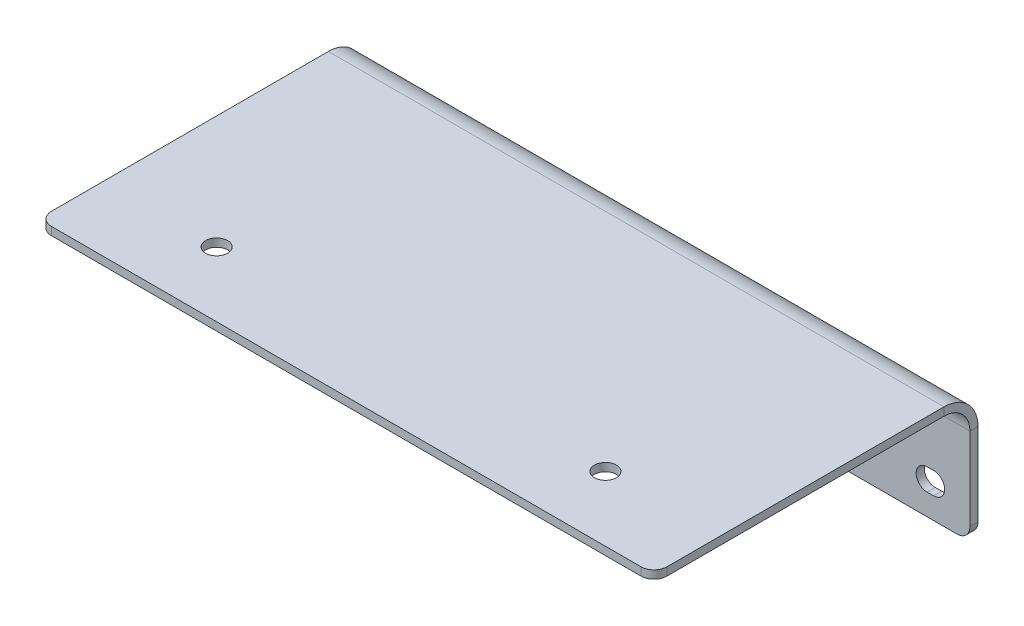
from build123d import *

# Parameters (mm, degrees)
SKETCH2_W                    = 120.65
SKETCH2_H                    = 1.5875
BASE_FLANGE1_DEPTH           = 25.4
EDGE_FLANGE1_STRIP_W         = 16.51
EDGE_FLANGE1_STRIP_H         = 1.5875
EDGE_FLANGE1_STRIP_CUT_DEPTH = 120.65
EDGE_FLANGE1_DEPTH           = 120.65
FILLET1_R                    = 2.54
CUT_EXTRUDE1_DEPTH           = 138.966445762
SKETCH11_R                   = 2.15265
CUT_EXTRUDE2_DEPTH           = 139.404146095


# Sheet-metal steps are written as plain solids
with BuildPart() as part:
    # Sketch2 → Base-Flange1 (new body)
    with BuildSketch(Plane(origin=(0, 0, 0), x_dir=(1, 0, 0), z_dir=(0, 1, 0))):
        with Locations((60.325, -0.79375)):
            Rectangle(SKETCH2_W, SKETCH2_H)
    extrude(amount=BASE_FLANGE1_DEPTH)

    # Edge-Flange1 strip (across the edge) → Edge-Flange1 strip cut (cut)
    with BuildSketch(Plane(origin=(120.65, 25.4, 1.5875), x_dir=(0, -1, 0), z_dir=(-1, 0, 0))):
        with Locations((-1.5875, -0.79375)):
            Rectangle(EDGE_FLANGE1_STRIP_W, EDGE_FLANGE1_STRIP_H)
    extrude(amount=EDGE_FLANGE1_STRIP_CUT_DEPTH, mode=Mode.SUBTRACT)

    # Edge-Flange1 section (across the edge) → Edge-Flange1 (add)
    with BuildSketch(Plane(origin=(120.65, 25.4, 1.5875), x_dir=(0, -1, 0), z_dir=(-1, 0, 0))):
        with BuildLine():
            Line((0, 5.08), (0, 61.9125))
            Line((0, 61.9125), (1.5875, 61.9125))
            Line((1.5875, 61.9125), (1.5875, 5.08))
            ThreePointArc((1.5875, 5.08), (3.075397552, 1.487897552), (6.6675, 0))
            Line((6.6675, 0), (6.6675, -1.5875))
            ThreePointArc((6.6675, -1.5875), (1.952865536, 0.365365536), (0, 5.08))
        make_face()
    extrude(amount=EDGE_FLANGE1_DEPTH)

    # Fillet1
    fillet1_edges = [part.edges().sort_by_distance(p)[0] for p in [
        (120.65, 24.60625, 63.5),
        (0, 24.60625, 63.5),
        (0, 0, 0.79375),
        (120.65, 0, 0.79375),
    ]]
    fillet(fillet1_edges, radius=FILLET1_R)

    # Sketch10 → Cut-Extrude1 (cut, through all)
    with BuildSketch(Plane.XY.offset(1.5875)):
        with BuildLine():
            Line((7.112, 8.50265), (8.382, 8.50265))
            ThreePointArc((8.382, 8.50265), (10.53465, 6.35), (8.382, 4.19735))
            Line((8.382, 4.19735), (7.112, 4.19735))
            ThreePointArc((7.112, 4.19735), (4.95935, 6.35), (7.112, 8.50265))
        make_face()
        with BuildLine():
            Line((112.268, 8.50265), (113.538, 8.50265))
            ThreePointArc((113.538, 8.50265), (115.69065, 6.35), (113.538, 4.19735))
            Line((113.538, 4.19735), (112.268, 4.19735))
            ThreePointArc((112.268, 4.19735), (110.11535, 6.35), (112.268, 8.50265))
        make_face()
    extrude(amount=-CUT_EXTRUDE1_DEPTH, mode=Mode.SUBTRACT)

    # Sketch11 → Cut-Extrude2 (cut, through all)
    with BuildSketch(Plane.XZ.offset(-23.8125)):
        with Locations(Location((22.225, 50.8, 0), (0, 0, 270))):
            Circle(SKETCH11_R)
        with Locations(Location((98.425, 50.8, 0), (0, 0, 270))):
            Circle(SKETCH11_R)
    extrude(amount=-CUT_EXTRUDE2_DEPTH, mode=Mode.SUBTRACT)


solid = part.part
